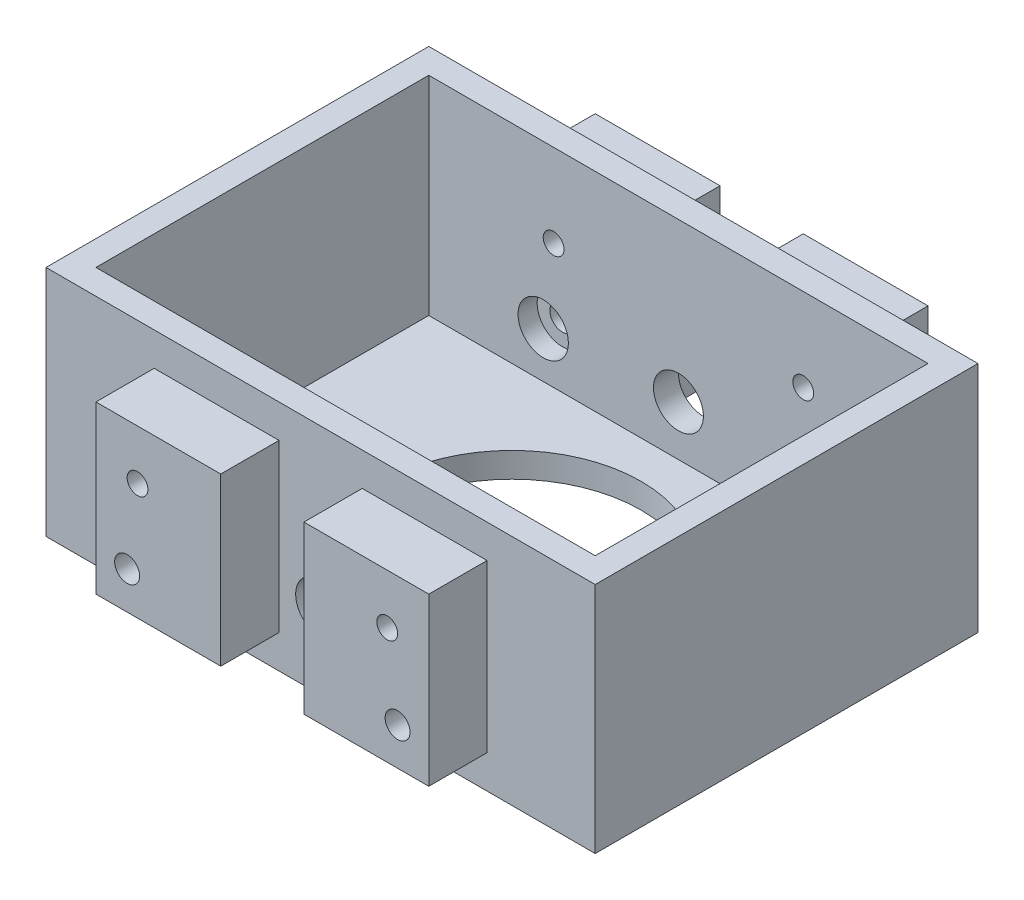
from build123d import *

# Parameters (mm, degrees)
SKETCH1_W               = 66
SKETCH1_H               = 46
BOSS_EXTRUDE2_DEPTH     = 3
SKETCH3_W               = 66
SKETCH3_H               = 46
SKETCH3_W_2             = 60
SKETCH3_H_2             = 40
BOSS_EXTRUDE4_DEPTH     = 25
SKETCH4_W               = 15
SKETCH4_H               = 20
BOSS_EXTRUDE5_DEPTH     = 7
CUT_EXTRUDE1_REACH      = 74.806
SKETCH5_R               = 1.5
SKETCH5_R_2             = 1.25
SKETCH6_W               = 15
SKETCH6_H               = 20
BOSS_EXTRUDE6_DEPTH     = 7
CUT_EXTRUDE2_START      = -10
SKETCH7_R               = 1.5
SKETCH7_R_2             = 1.25
CUT_EXTRUDE2_DEPTH      = 10
CUT_EXTRUDE3_REACH      = 71.125
SKETCH8_R               = 15.5
CUT_EXTRUDE6_DEPTH      = 73.806070335
CUT_EXTRUDE6_DEPTH_BACK = 73.806070335
SKETCH11_R              = 3
SKETCH12_R              = 3.025
CUT_EXTRUDE7_DEPTH      = 2.3
CUT_EXTRUDE8_START      = -2.3
SKETCH14_R              = 3.025
CUT_EXTRUDE8_DEPTH      = 2.3


with BuildPart() as part:
    # Sketch1 → Boss-Extrude2 (new body)
    with BuildSketch(Plane(origin=(0, 0, 0), x_dir=(1, 0, 0), z_dir=(0, 1, 0))):
        with Locations((-8.324615879, -17.817795916)):
            Rectangle(SKETCH1_W, SKETCH1_H)
    extrude(amount=BOSS_EXTRUDE2_DEPTH)

    # Sketch3 → Boss-Extrude4 (add)
    with BuildSketch(Plane(origin=(0, 3, 0), x_dir=(1, 0, 0), z_dir=(0, 1, 0))):
        with Locations((-8.324615879, -17.817795916)):
            Rectangle(SKETCH3_W, SKETCH3_H)
        with Locations((-8.324615879, -17.817795916)):
            Rectangle(SKETCH3_W_2, SKETCH3_H_2, mode=Mode.SUBTRACT)
    extrude(amount=BOSS_EXTRUDE4_DEPTH)

    # Sketch4 → Boss-Extrude5 (add)
    with BuildSketch(Plane.XY.offset(40.817795916)):
        with Locations((-20.824615879, 14)):
            Rectangle(SKETCH4_W, SKETCH4_H)
        with Locations((4.175384121, 14)):
            Rectangle(SKETCH4_W, SKETCH4_H)
    extrude(amount=BOSS_EXTRUDE5_DEPTH)

    # Sketch5 → Cut-Extrude1 (cut, up to next)
    with BuildSketch(Plane.XY.offset(47.817795916), mode=Mode.PRIVATE) as cut_extrude1_sk1:
        with Locations((-24.574615879, 8.5)):
            Circle(SKETCH5_R)
    cut_extrude1_tool1 = extrude(cut_extrude1_sk1.sketch, amount=-CUT_EXTRUDE1_REACH, mode=Mode.PRIVATE) & part.part
    # Sketch5 → Cut-Extrude1 (cut, up to next)
    with BuildSketch(Plane.XY.offset(47.817795916), mode=Mode.PRIVATE) as cut_extrude1_sk2:
        with Locations((7.925384121, 8.5)):
            Circle(SKETCH5_R)
    cut_extrude1_tool2 = extrude(cut_extrude1_sk2.sketch, amount=-CUT_EXTRUDE1_REACH, mode=Mode.PRIVATE) & part.part
    # Sketch5 → Cut-Extrude1 (cut, up to next)
    with BuildSketch(Plane.XY.offset(47.817795916), mode=Mode.PRIVATE) as cut_extrude1_sk3:
        with Locations((6.675384121, 18)):
            Circle(SKETCH5_R_2)
    cut_extrude1_tool3 = extrude(cut_extrude1_sk3.sketch, amount=-CUT_EXTRUDE1_REACH, mode=Mode.PRIVATE) & part.part
    # Sketch5 → Cut-Extrude1 (cut, up to next)
    with BuildSketch(Plane.XY.offset(47.817795916), mode=Mode.PRIVATE) as cut_extrude1_sk4:
        with Locations((-23.324615879, 18)):
            Circle(SKETCH5_R_2)
    cut_extrude1_tool4 = extrude(cut_extrude1_sk4.sketch, amount=-CUT_EXTRUDE1_REACH, mode=Mode.PRIVATE) & part.part
    add(cut_extrude1_tool1.solids().sort_by_distance((-24.574616, 8.5, 47.817796))[0], mode=Mode.SUBTRACT)
    add(cut_extrude1_tool2.solids().sort_by_distance((7.925384, 8.5, 47.817796))[0], mode=Mode.SUBTRACT)
    add(cut_extrude1_tool3.solids().sort_by_distance((6.675384, 18, 47.817796))[0], mode=Mode.SUBTRACT)
    add(cut_extrude1_tool4.solids().sort_by_distance((-23.324616, 18, 47.817796))[0], mode=Mode.SUBTRACT)

    # Sketch6 → Boss-Extrude6 (add)
    with BuildSketch(Plane(origin=(0, 0, -5.182204084), x_dir=(-1, 0, 0), z_dir=(0, 0, -1))):
        with Locations((-4.175384121, 14)):
            Rectangle(SKETCH6_W, SKETCH6_H)
        with Locations((20.824615879, 14)):
            Rectangle(SKETCH6_W, SKETCH6_H)
    extrude(amount=BOSS_EXTRUDE6_DEPTH)

    # Sketch7 → Cut-Extrude2 (cut)
    with BuildSketch(Plane(origin=(0, 0, -12.182204084), x_dir=(-1, 0, 0), z_dir=(0, 0, -1)).offset(CUT_EXTRUDE2_START)):
        with Locations((-7.925384121, 8.5)):
            Circle(SKETCH7_R)
        with Locations((24.574615879, 8.5)):
            Circle(SKETCH7_R)
        with Locations((23.324615879, 18)):
            Circle(SKETCH7_R_2)
        with Locations((-6.675384121, 18)):
            Circle(SKETCH7_R_2)
    extrude(amount=CUT_EXTRUDE2_DEPTH, mode=Mode.SUBTRACT)

    # Sketch8 → Cut-Extrude3 (cut, up to next)
    with BuildSketch(Plane(origin=(0, 0, 0), x_dir=(-1, 0, 0), z_dir=(0, -1, 0)), mode=Mode.PRIVATE) as cut_extrude3_sk1:
        with Locations((8.324615879, -17.817795916)):
            Circle(SKETCH8_R)
    cut_extrude3_tool1 = extrude(cut_extrude3_sk1.sketch, amount=-CUT_EXTRUDE3_REACH, mode=Mode.PRIVATE) & part.part
    add(cut_extrude3_tool1.solids().sort_by_distance((-8.324616, 0, 17.817796))[0], mode=Mode.SUBTRACT)

    # Sketch11 → Cut-Extrude6 (cut, two sides: drawn at the far end of the back side and taken through both)
    with BuildSketch(Plane.XY.offset(40.817795916).offset(-CUT_EXTRUDE6_DEPTH_BACK)):
        with Locations((-8.324615879, 9)):
            Circle(SKETCH11_R)
    extrude(amount=CUT_EXTRUDE6_DEPTH + CUT_EXTRUDE6_DEPTH_BACK, mode=Mode.SUBTRACT)

    # Sketch12 → Cut-Extrude7 (cut)
    with BuildSketch(Plane(origin=(0, 0, 37.817795916), x_dir=(-1, 0, 0), z_dir=(0, 0, -1))):
        with Locations((24.574615879, 8.5)):
            Circle(SKETCH12_R)
        with Locations((-7.925384121, 8.5)):
            Circle(SKETCH12_R)
    extrude(amount=-CUT_EXTRUDE7_DEPTH, mode=Mode.SUBTRACT)

    # Sketch14 → Cut-Extrude8 (cut)
    with BuildSketch(Plane.XY.offset(-2.182204084).offset(CUT_EXTRUDE8_START)):
        with Locations((-24.574615879, 8.5)):
            Circle(SKETCH14_R)
        with Locations((7.925384121, 8.5)):
            Circle(SKETCH14_R)
    extrude(amount=CUT_EXTRUDE8_DEPTH, mode=Mode.SUBTRACT)


solid = part.part
